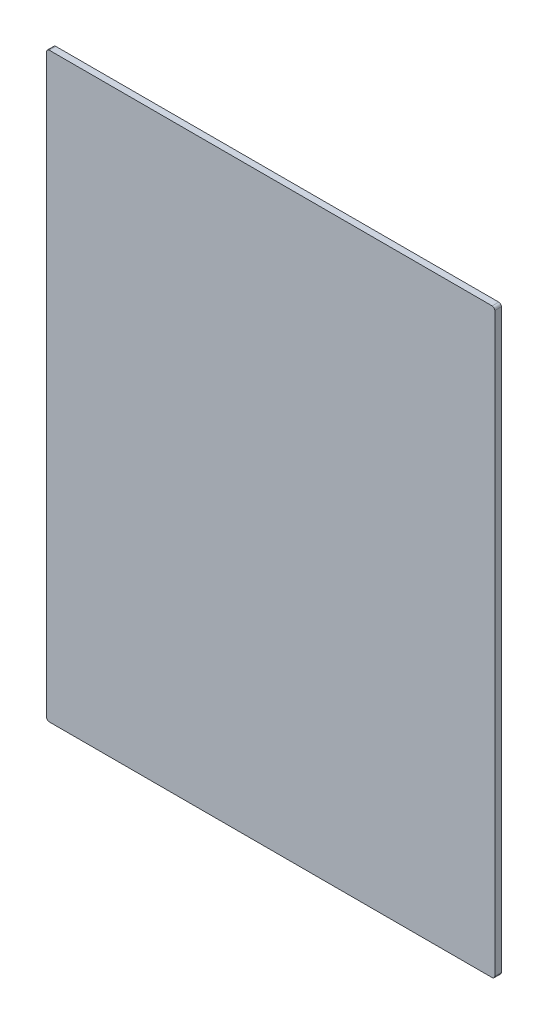
from build123d import *

# Parameters (mm, degrees)
SKETCH1_W           = 431.8
SKETCH1_H           = 560.466887406
BOSS_EXTRUDE1_DEPTH = 6.35
FILLET1_R           = 2.54


with BuildPart() as part:
    # Sketch1 → Boss-Extrude1 (new body)
    with BuildSketch(Plane.XY):
        with Locations((177.8, -242.133443703)):
            Rectangle(SKETCH1_W, SKETCH1_H)
    extrude(amount=BOSS_EXTRUDE1_DEPTH)

    # Fillet1
    fillet1_edges = [part.edges().sort_by_distance(p)[0] for p in [
        (393.7, 38.1, 3.175),
        (393.7, -522.366887406, 3.175),
        (-38.1, -522.366887406, 3.175),
        (-38.1, 38.1, 3.175),
    ]]
    fillet(fillet1_edges, radius=FILLET1_R)


solid = part.part
